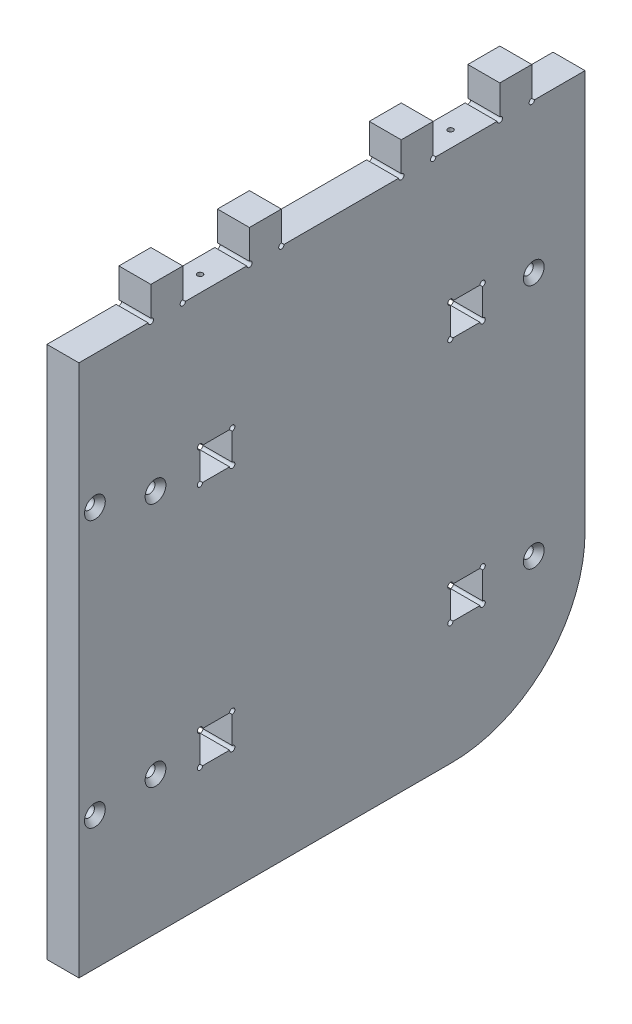
from build123d import *

# Parameters (mm, degrees)
SKETCH1_R                 = 2
SKETCH1_W                 = 12.1
SKETCH1_H                 = 12.1
BOSS_EXTRUDE1_DEPTH       = 12
CUT_EXTRUDE2_START        = 103.950538
SKETCH4_R                 = 0.9921875
CUT_EXTRUDE2_DEPTH        = 15
SKETCH5_R                 = 1
CUT_EXTRUDE3_DEPTH        = 15
ADVANCEDHOLE2_OUTLINE_R   = 1.89865
ADVANCEDHOLE2_DEPTH       = 2.301024407
ADVANCEDHOLE2_DRAFT       = -41
ADVANCEDHOLE2_2_OUTLINE_R = 1.89865
ADVANCEDHOLE2_2_DEPTH     = 2.301024407
ADVANCEDHOLE2_2_DRAFT     = -41
SKETCH8_R                 = 2
CUT_EXTRUDE4_DEPTH        = 154.260488233


# Read off the part's stored shape, not the designer's step: AdvancedHole1, AdvancedHole2
with BuildPart() as part:
    # Sketch1 → Boss-Extrude1 (new body)
    with BuildSketch(Plane(origin=(0, 0, 0), x_dir=(0, 0, -1), z_dir=(1, 0, 0))):
        with BuildLine():
            Line((-72.5, 115.950537961), (-72.5, 103.950537961))
            Line((-72.5, 103.950537961), (-99.5, 103.950537961))
            Line((-99.5, 103.950537961), (-99.5, -96.049462039))
            Line((-99.5, -96.049462039), (40.5, -96.049462039))
            ThreePointArc((40.5, -96.049462039), (75.855339059, -81.404801099), (90.5, -46.049462039))
            Line((90.5, -46.049462039), (90.5, 103.950537961))
            Line((90.5, 103.950537961), (70.5, 103.950537961))
            Line((70.5, 103.950537961), (70.5, 115.950537961))
            Line((70.5, 115.950537961), (58.5, 115.950537961))
            Line((58.5, 115.950537961), (58.5, 103.950537961))
            Line((58.5, 103.950537961), (33.5, 103.950537961))
            Line((33.5, 103.950537961), (33.5, 115.950537961))
            Line((33.5, 115.950537961), (21.5, 115.950537961))
            Line((21.5, 115.950537961), (21.5, 103.950537961))
            Line((21.5, 103.950537961), (-23.5, 103.950537961))
            Line((-23.5, 103.950537961), (-23.5, 115.950537961))
            Line((-23.5, 115.950537961), (-35.5, 115.950537961))
            Line((-35.5, 115.950537961), (-35.5, 103.950537961))
            Line((-35.5, 103.950537961), (-60.5, 103.950537961))
            Line((-60.5, 103.950537961), (-60.5, 115.950537961))
            Line((-60.5, 115.950537961), (-72.5, 115.950537961))
        make_face()
        with Locations((71.25, 47.900537961)):
            Circle(SKETCH1_R, mode=Mode.SUBTRACT)
        with Locations((71.25, -44.199462039)):
            Circle(SKETCH1_R, mode=Mode.SUBTRACT)
        with Locations((-70.75, 47.900537961)):
            Circle(SKETCH1_R, mode=Mode.SUBTRACT)
        with Locations((-70.75, -44.199462039)):
            Circle(SKETCH1_R, mode=Mode.SUBTRACT)
        with Locations((46, 47.900537961)):
            Rectangle(SKETCH1_W, SKETCH1_H, mode=Mode.SUBTRACT)
        with Locations((46, -44.199462039)):
            Rectangle(SKETCH1_W, SKETCH1_H, mode=Mode.SUBTRACT)
        with Locations((-48, 47.900537961)):
            Rectangle(SKETCH1_W, SKETCH1_H, mode=Mode.SUBTRACT)
        with Locations((-48, -44.199462039)):
            Rectangle(SKETCH1_W, SKETCH1_H, mode=Mode.SUBTRACT)
    extrude(amount=BOSS_EXTRUDE1_DEPTH)

    # Sketch4 → Cut-Extrude2 (cut)
    with BuildSketch(Plane(origin=(0, 0, 0), x_dir=(1, 0, 0), z_dir=(0, 1, 0)).offset(CUT_EXTRUDE2_START)):
        with Locations(Location((6, 46, 0), (0, 0, 90))):
            Circle(SKETCH4_R)
        with Locations(Location((6, -48, 0), (0, 0, 90))):
            Circle(SKETCH4_R)
    extrude(amount=-CUT_EXTRUDE2_DEPTH, mode=Mode.SUBTRACT)

    # Sketch5 → Cut-Extrude3 (cut)
    with BuildSketch(Plane(origin=(0, 0, 0), x_dir=(0, 0, -1), z_dir=(1, 0, 0))):
        with Locations((-54.05, 53.950537961)):
            Circle(SKETCH5_R)
        with Locations((-41.95, 53.950537961)):
            Circle(SKETCH5_R)
        with Locations((-41.95, 41.850537961)):
            Circle(SKETCH5_R)
        with Locations((-54.05, 41.850537961)):
            Circle(SKETCH5_R)
        with Locations((39.95, 53.950537961)):
            Circle(SKETCH5_R)
        with Locations((52.05, 53.950537961)):
            Circle(SKETCH5_R)
        with Locations((52.05, 41.850537961)):
            Circle(SKETCH5_R)
        with Locations((39.95, 41.850537961)):
            Circle(SKETCH5_R)
        with Locations((-41.95, -38.149462039)):
            Circle(SKETCH5_R)
        with Locations((-54.05, -38.149462039)):
            Circle(SKETCH5_R)
        with Locations((-41.95, -50.249462039)):
            Circle(SKETCH5_R)
        with Locations((-54.05, -50.249462039)):
            Circle(SKETCH5_R)
        with Locations((39.95, -38.149462039)):
            Circle(SKETCH5_R)
        with Locations((52.05, -38.149462039)):
            Circle(SKETCH5_R)
        with Locations((52.05, -50.249462039)):
            Circle(SKETCH5_R)
        with Locations((39.95, -50.249462039)):
            Circle(SKETCH5_R)
        with Locations((21.5, 103.950537961)):
            Circle(SKETCH5_R)
        with Locations((33.5, 103.950537961)):
            Circle(SKETCH5_R)
        with Locations((58.5, 103.950537961)):
            Circle(SKETCH5_R)
        with Locations((70.5, 103.950537961)):
            Circle(SKETCH5_R)
        with Locations((-23.5, 103.950537961)):
            Circle(SKETCH5_R)
        with Locations((-35.5, 103.950537961)):
            Circle(SKETCH5_R)
        with Locations((-60.5, 103.950537961)):
            Circle(SKETCH5_R)
        with Locations((-72.5, 103.950537961)):
            Circle(SKETCH5_R)
    extrude(amount=CUT_EXTRUDE3_DEPTH, mode=Mode.SUBTRACT)

    # AdvancedHole1 outline → AdvancedHole1 (revolve, cut)
    with BuildSketch(Plane(origin=(0, -44.199462039, 70.75), x_dir=(0, 1, 0), z_dir=(0, 0, -1))):
        Polygon((2, 12), (2, 9.815565432), (3.8989, 12), align=None)
    revolve(axis=Axis((0, -44.199462039, 70.75), (1, 0, 0)), mode=Mode.SUBTRACT)

    # AdvancedHole1 2 outline → AdvancedHole1 2 (revolve, cut)
    with BuildSketch(Plane(origin=(0, 47.900537961, 70.75), x_dir=(0, 1, 0), z_dir=(0, 0, -1))):
        Polygon((2, 12), (2, 9.815565432), (3.8989, 12), align=None)
    revolve(axis=Axis((0, 47.900537961, 70.75), (1, 0, 0)), mode=Mode.SUBTRACT)

    # AdvancedHole1 3 outline → AdvancedHole1 3 (revolve, cut)
    with BuildSketch(Plane(origin=(0, -44.199462039, -71.25), x_dir=(0, 1, 0), z_dir=(0, 0, -1))):
        Polygon((2, 12), (2, 9.815565432), (3.8989, 12), align=None)
    revolve(axis=Axis((0, -44.199462039, -71.25), (1, 0, 0)), mode=Mode.SUBTRACT)

    # AdvancedHole1 4 outline → AdvancedHole1 4 (revolve, cut)
    with BuildSketch(Plane(origin=(0, 47.900537961, -71.25), x_dir=(0, 1, 0), z_dir=(0, 0, -1))):
        Polygon((2, 12), (2, 9.815565432), (3.8989, 12), align=None)
    revolve(axis=Axis((0, 47.900537961, -71.25), (1, 0, 0)), mode=Mode.SUBTRACT)


with BuildPart() as advancedhole2_tool:
    # AdvancedHole2 outline → AdvancedHole2 (with draft: the straight prism first)
    with BuildSketch(Plane.YZ.offset(9.698975593)):
        with Locations((-46.049462039, 93.5)):
            Circle(ADVANCEDHOLE2_OUTLINE_R)
    extrude(amount=ADVANCEDHOLE2_DEPTH)
    # AdvancedHole2: the draft: its side faces are tilted about the plane it starts from
    advancedhole2_sides = [advancedhole2_tool.faces().sort_by_distance(p)[0] for p in [
        (10.849487797, -47.948112039, 93.5),
    ]]
    draft(advancedhole2_sides, Plane.YZ.offset(9.698975593), ADVANCEDHOLE2_DRAFT)


with BuildPart() as part_1:
    add(part.part)

    # AdvancedHole2: cut by advancedhole2_tool
    add(advancedhole2_tool.part, mode=Mode.SUBTRACT)


with BuildPart() as advancedhole2_2_tool:
    # AdvancedHole2 2 outline → AdvancedHole2 2 (with draft: the straight prism first)
    with BuildSketch(Plane.YZ.offset(9.698975593)):
        with Locations((53.950537961, 93.5)):
            Circle(ADVANCEDHOLE2_2_OUTLINE_R)
    extrude(amount=ADVANCEDHOLE2_2_DEPTH)
    # AdvancedHole2 2: the draft: its side faces are tilted about the plane it starts from
    advancedhole2_2_sides = [advancedhole2_2_tool.faces().sort_by_distance(p)[0] for p in [
        (10.849487797, 52.051887961, 93.5),
    ]]
    draft(advancedhole2_2_sides, Plane.YZ.offset(9.698975593), ADVANCEDHOLE2_2_DRAFT)


with BuildPart() as part_2:
    add(part_1.part)

    # AdvancedHole2 2: cut by advancedhole2_2_tool
    add(advancedhole2_2_tool.part, mode=Mode.SUBTRACT)

    # Sketch8 → Cut-Extrude4 (cut, through all)
    with BuildSketch(Plane(origin=(12, 0, 0), x_dir=(0, 0, -1), z_dir=(1, 0, 0))):
        with Locations((-93.5, 53.950537961)):
            Circle(SKETCH8_R)
        with Locations((-93.5, -46.049462039)):
            Circle(SKETCH8_R)
    extrude(amount=-CUT_EXTRUDE4_DEPTH, mode=Mode.SUBTRACT)


solid = part_2.part
